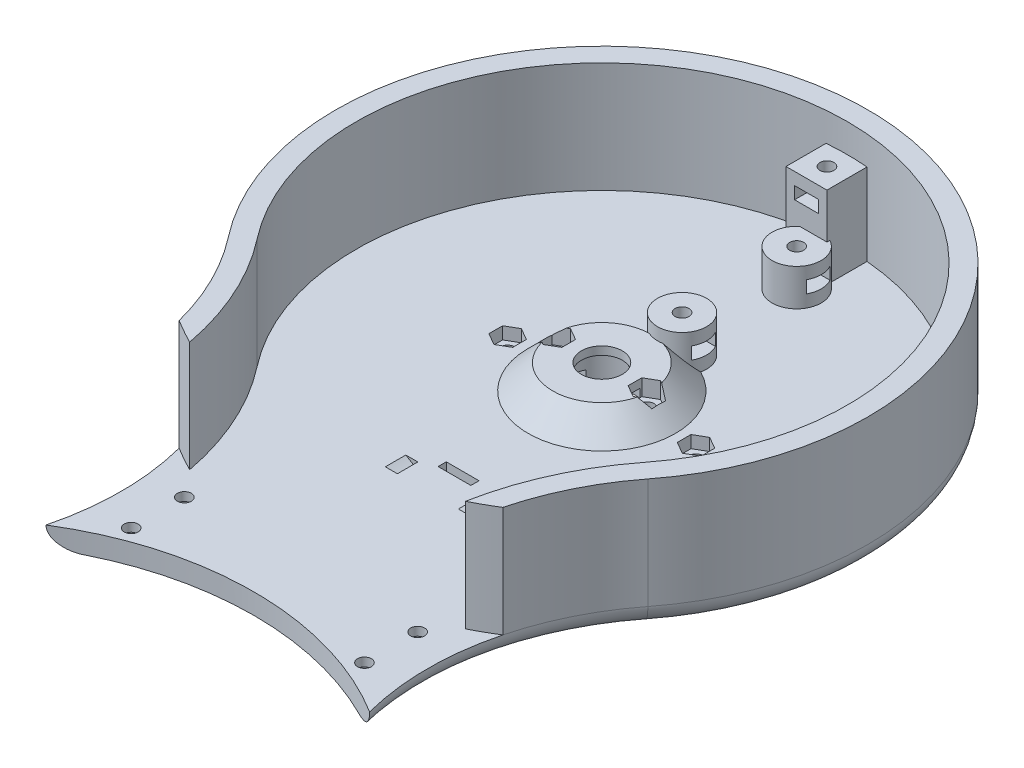
from build123d import *

# Parameters (mm, degrees)
SALIENTE_EXTRUIR1_DEPTH      = 32
CORTAR_EXTRUIR1_DEPTH        = 27
SALIENTE_EXTRUIR2_START      = 20
SALIENTE_EXTRUIR2_DEPTH      = 20
CROQUIS4_R                   = 1.7
CORTAR_EXTRUIR2_DEPTH        = 16
CORTAR_EXTRUIR3_DEPTH        = 1.5
CROQUIS7_R                   = 5
CORTAR_EXTRUIR4_DEPTH        = 11
CROQUIS8_R                   = 8.2
CORTAR_EXTRUIR5_DEPTH        = 9
CROQUIS9_W                   = 30.6
CROQUIS9_H                   = 7
CORTAR_EXTRUIR6_DEPTH        = 4
CROQUIS10_R                  = 1.7
CORTAR_EXTRUIR7_DEPTH        = 16
CORTAR_EXTRUIR8_DEPTH        = 4
CROQUIS12_W                  = 5
CROQUIS12_H                  = 1.5
SALIENTE_EXTRUIR3_START      = 5
SALIENTE_EXTRUIR3_DEPTH      = 5
CROQUIS14_W                  = 4
CROQUIS14_H                  = 1.5
CROQUIS15_R                  = 1.7
CORTAR_EXTRUIR9_DEPTH        = 28
CROQUIS16_R                  = 2.95
CORTAR_EXTRUIR10_DEPTH       = 2.9
SALIENTE_EXTRUIR4_DEPTH      = 3
SALIENTE_EXTRUIR4_DEPTH_BACK = 3
CROQUIS18_R                  = 6
CROQUIS18_R_2                = 1.7
SALIENTE_EXTRUIR5_DEPTH      = 9
CORTAR_EXTRUIR11_DEPTH       = 1.5
CORTAR_EXTRUIR11_DEPTH_BACK  = 1.5
MATRIZL1_START               = 8
MATRIZL1_OUTLINE_R           = 1.7
MATRIZL1_DEPTH               = 3
MATRIZL1_START_2             = 5
MATRIZL1_2_DEPTH             = 9
MATRIZL1_3_OUTLINE_R         = 1.7
MATRIZL1_3_DEPTH             = 3
MATRIZL1_START_3             = 11
MATRIZL1_4_OUTLINE_R         = 1.7
MATRIZL1_4_DEPTH             = 3
MATRIZC1_START               = 8
MATRIZC1_OUTLINE_R           = 1.7
MATRIZC1_DEPTH               = 2.8876
MATRIZC1_START_2             = 5
MATRIZC1_2_DEPTH             = 9
MATRIZC1_3_OUTLINE_R         = 1.7
MATRIZC1_3_DEPTH             = 3
MATRIZC1_START_3             = 11
MATRIZC1_4_OUTLINE_R         = 1.7
MATRIZC1_4_DEPTH             = 3
CROQUIS20_R                  = 4.2
CORTAR_EXTRUIR12_DEPTH       = 1.1
REDONDEO1_R                  = 5
CROQUIS21_R                  = 75
CORTAR_EXTRUIR13_DEPTH       = 57
CORTAR_EXTRUIR14_DEPTH       = 27
CROQUIS23_R                  = 1.7
CORTAR_EXTRUIR15_DEPTH       = 10
CORTAR_EXTRUIR16_DEPTH       = 3
CROQUIS25_W                  = 8
CROQUIS25_H                  = 2
CORTAR_EXTRUIR17_DEPTH       = 9


# Read off the part's stored shape, not the designer's step: MatrizL1, MatrizC1
with BuildPart() as part:
    # Croquis1 → Saliente-Extruir1 (new body)
    with BuildSketch(Plane(origin=(0, 0, 0), x_dir=(1, 0, 0), z_dir=(0, 1, 0))):
        with BuildLine():
            ThreePointArc((51.23475383, 120), (0, 225), (-51.23475383, 120))
            ThreePointArc((-51.23475383, 120), (-37.46950766, 80), (-51.23475383, 40))
            ThreePointArc((-51.23475383, 40), (0, -65), (51.23475383, 40))
            ThreePointArc((51.23475383, 40), (37.46950766, 80), (51.23475383, 120))
        make_face()
    extrude(amount=SALIENTE_EXTRUIR1_DEPTH)

    # Croquis2 → Cortar-Extruir1 (cut)
    with BuildSketch(Plane(origin=(0, 32, 0), x_dir=(1, 0, 0), z_dir=(0, 1, 0))):
        with BuildLine():
            ThreePointArc((47.29361892, 123.076923077), (32.46950766, 80), (47.29361892, 36.923076923))
            ThreePointArc((47.29361892, 36.923076923), (0, -60), (-47.29361892, 36.923076923))
            ThreePointArc((-47.29361892, 36.923076923), (-32.46950766, 80), (-47.29361892, 123.076923077))
            ThreePointArc((-47.29361892, 123.076923077), (0, 220), (47.29361892, 123.076923077))
        make_face()
    extrude(amount=-CORTAR_EXTRUIR1_DEPTH, mode=Mode.SUBTRACT)

    # Croquis3 → Saliente-Extruir2 (add)
    with BuildSketch(Plane(origin=(0, 5, 0), x_dir=(1, 0, 0), z_dir=(0, 1, 0)).offset(SALIENTE_EXTRUIR2_START)):
        with BuildLine():
            Line((-5, -50), (5, -50))
            Line((5, -50), (5, -59.791303716))
            ThreePointArc((5, -59.791303716), (0, -60), (-5, -59.791303716))
            Line((-5, -59.791303716), (-5, -50))
        make_face()
    saliente_extruir2 = extrude(amount=-SALIENTE_EXTRUIR2_DEPTH)

    # Croquis4 → Cortar-Extruir2 (cut)
    with BuildSketch(Plane(origin=(0, 25, 0), x_dir=(1, 0, 0), z_dir=(0, 1, 0))):
        with Locations(Location((0, -55, 0), (0, 0, 270))):
            Circle(CROQUIS4_R)
    cortar_extruir2 = extrude(amount=-CORTAR_EXTRUIR2_DEPTH, mode=Mode.SUBTRACT)

    # Croquis5 → Cortar-Extruir3 (cut, symmetric)
    with BuildSketch(Plane(origin=(0, 20.5, 0), x_dir=(1, 0, 0), z_dir=(0, 1, 0))):
        Polygon((-2.901185103, -53.325), (-2.901185103, -46.675), (2.901185103, -46.675), (2.901185103, -53.325), (2.901185103, -56.675), (0, -58.35), (-2.901185103, -56.675), align=None)
    cortar_extruir3 = extrude(amount=CORTAR_EXTRUIR3_DEPTH, both=True, mode=Mode.SUBTRACT)

    # Croquis6 → Revolución1 (revolve)
    with BuildSketch(Plane.XY, mode=Mode.PRIVATE) as revoluci_n1_sk:
        Polygon((0, 11), (0, 5), (18, 5), (12, 11), align=None)
    revoluci_n1 = revolve(revoluci_n1_sk.sketch.rotate(Axis((0, 11, 0), (0, -1, 0)), 180), axis=Axis((0, 11, 0), (0, -1, 0)))

    # Croquis7 → Cortar-Extruir4 (cut)
    with BuildSketch(Plane(origin=(0, 11, 0), x_dir=(1, 0, 0), z_dir=(0, 1, 0))):
        with Locations(Location((0, 0, 0), (0, 0, 180))):
            Circle(CROQUIS7_R)
    cortar_extruir4 = extrude(amount=-CORTAR_EXTRUIR4_DEPTH, mode=Mode.SUBTRACT)

    # Croquis8 → Cortar-Extruir5 (cut)
    with BuildSketch(Plane.XZ):
        with Locations(Location((0, 0, 0), (0, 0, 270))):
            Circle(CROQUIS8_R)
    cortar_extruir5 = extrude(amount=-CORTAR_EXTRUIR5_DEPTH, mode=Mode.SUBTRACT)

    # Croquis9 → Cortar-Extruir6 (cut)
    with BuildSketch(Plane.XZ):
        Rectangle(CROQUIS9_W, CROQUIS9_H)
    cortar_extruir6 = extrude(amount=-CORTAR_EXTRUIR6_DEPTH, mode=Mode.SUBTRACT)

    # Croquis10 → Cortar-Extruir7 (cut)
    with BuildSketch(Plane.XZ.offset(-4)):
        with Locations(Location((-11, 0, 0), (0, 0, 270))):
            Circle(CROQUIS10_R)
        with Locations(Location((11, 0, 0), (0, 0, 270))):
            Circle(CROQUIS10_R)
    cortar_extruir7 = extrude(amount=-CORTAR_EXTRUIR7_DEPTH, mode=Mode.SUBTRACT)

    # Croquis11 → Cortar-Extruir8 (cut)
    with BuildSketch(Plane(origin=(0, 11, 0), x_dir=(1, 0, 0), z_dir=(0, 1, 0))):
        Polygon((11, 3.35), (8.098814897, 1.675), (8.098814897, -1.675), (11, -3.35), (13.901185103, -1.675), (13.901185103, 1.675), align=None)
        Polygon((-11, 3.35), (-13.901185103, 1.675), (-13.901185103, -1.675), (-11, -3.35), (-8.098814897, -1.675), (-8.098814897, 1.675), align=None)
    cortar_extruir8 = extrude(amount=-CORTAR_EXTRUIR8_DEPTH, mode=Mode.SUBTRACT)

    # Croquis12 → Cortar-Revolución1 (revolve, cut)
    with BuildSketch(Plane(origin=(0, 0, 0), x_dir=(0, 0, -1), z_dir=(1, 0, 0))):
        with Locations((40, 2.5)):
            Rectangle(CROQUIS12_W, CROQUIS12_H)
    cortar_revoluci_n1 = revolve(axis=Axis((0, 20, -15.980405029), (0, 0, -1)), mode=Mode.SUBTRACT)

    # Simetría1: Saliente-Extruir2, Cortar-Extruir2, Cortar-Extruir3, Revolución1, Cortar-Extruir4, Cortar-Extruir5, Cortar-Extruir6, Cortar-Extruir7, Cortar-Extruir8, Cortar-Revolución1 across plane
    add(saliente_extruir2.mirror(Plane.XY.offset(-80)))
    add(cortar_extruir2.mirror(Plane.XY.offset(-80)), mode=Mode.SUBTRACT)
    add(cortar_extruir3.mirror(Plane.XY.offset(-80)), mode=Mode.SUBTRACT)
    add(revoluci_n1.mirror(Plane.XY.offset(-80)))
    add(cortar_extruir4.mirror(Plane.XY.offset(-80)), mode=Mode.SUBTRACT)
    add(cortar_extruir5.mirror(Plane.XY.offset(-80)), mode=Mode.SUBTRACT)
    add(cortar_extruir6.mirror(Plane.XY.offset(-80)), mode=Mode.SUBTRACT)
    add(cortar_extruir7.mirror(Plane.XY.offset(-80)), mode=Mode.SUBTRACT)
    add(cortar_extruir8.mirror(Plane.XY.offset(-80)), mode=Mode.SUBTRACT)
    add(cortar_revoluci_n1.mirror(Plane.XY.offset(-80)), mode=Mode.SUBTRACT)

    # Croquis13 → Saliente-Extruir3 (add)
    with BuildSketch(Plane(origin=(0, 5, 0), x_dir=(1, 0, 0), z_dir=(0, 1, 0)).offset(SALIENTE_EXTRUIR3_START)):
        with BuildLine():
            ThreePointArc((-33.685420375, 67.009644486), (-32.46950766, 80), (-33.685420375, 92.990355514))
            ThreePointArc((-33.685420375, 92.990355514), (0, 85), (33.685420375, 92.990355514))
            ThreePointArc((33.685420375, 92.990355514), (32.46950766, 80), (33.685420375, 67.009644486))
            ThreePointArc((33.685420375, 67.009644486), (0, 75), (-33.685420375, 67.009644486))
        make_face()
    extrude(amount=-SALIENTE_EXTRUIR3_DEPTH)

    # Croquis14 → Cortar-Revolución2 (revolve, cut)
    with BuildSketch(Plane(origin=(0, 0, 0), x_dir=(0, 0, -1), z_dir=(1, 0, 0))):
        with Locations((80, 7.75)):
            Rectangle(CROQUIS14_W, CROQUIS14_H)
    revolve(axis=Axis((0, 25, -45.111701589), (0, 0, -1)), mode=Mode.SUBTRACT)

    # Croquis15 → Cortar-Extruir9 (cut)
    with BuildSketch(Plane(origin=(0, 10, 0), x_dir=(1, 0, 0), z_dir=(0, 1, 0))):
        with Locations(Location((-28.5, 86.5, 0), (0, 0, 270))):
            Circle(CROQUIS15_R)
        with Locations(Location((-28.5, 73.5, 0), (0, 0, 270))):
            Circle(CROQUIS15_R)
        with Locations(Location((28.5, 86.5, 0), (0, 0, 270))):
            Circle(CROQUIS15_R)
        with Locations(Location((28.5, 73.5, 0), (0, 0, 270))):
            Circle(CROQUIS15_R)
    extrude(amount=-CORTAR_EXTRUIR9_DEPTH, mode=Mode.SUBTRACT)

    # Croquis16 → Cortar-Extruir10 (cut)
    with BuildSketch(Plane.XZ):
        with Locations(Location((-28.5, -73.5, 0), (0, 0, 270))):
            Circle(CROQUIS16_R)
        with Locations(Location((-28.5, -86.5, 0), (0, 0, 270))):
            Circle(CROQUIS16_R)
        with Locations(Location((28.5, -86.5, 0), (0, 0, 270))):
            Circle(CROQUIS16_R)
        with Locations(Location((28.5, -73.5, 0), (0, 0, 270))):
            Circle(CROQUIS16_R)
    extrude(amount=-CORTAR_EXTRUIR10_DEPTH, mode=Mode.SUBTRACT)

    # Croquis17 → Saliente-Extruir4 (add, two sides: drawn at the far end of the back side and taken through both)
    with BuildSketch(Plane.XY.offset(-80).offset(-SALIENTE_EXTRUIR4_DEPTH_BACK)):
        Polygon((-35, 24), (-35, 14), (-25, 24), align=None)
        Polygon((25, 24), (35, 24), (35, 14), align=None)
    extrude(amount=SALIENTE_EXTRUIR4_DEPTH + SALIENTE_EXTRUIR4_DEPTH_BACK)

    # Croquis18 → Saliente-Extruir5 (add)
    with BuildSketch(Plane(origin=(0, 5, 0), x_dir=(1, 0, 0), z_dir=(0, 1, 0))):
        with Locations((-2.2, -45.4)):
            Circle(CROQUIS18_R)
        with Locations(Location((-2.2, -45.4, 0), (0, 0, 270))):
            Circle(CROQUIS18_R_2, mode=Mode.SUBTRACT)
    extrude(amount=SALIENTE_EXTRUIR5_DEPTH)

    # Croquis19 → Cortar-Extruir11 (cut, two sides: drawn at the far end of the back side and taken through both)
    with BuildSketch(Plane(origin=(0, 9.5, 0), x_dir=(1, 0, 0), z_dir=(0, 1, 0)).offset(-CORTAR_EXTRUIR11_DEPTH_BACK)):
        Polygon((-3.875, -42.498814897), (-10.525, -42.498814897), (-10.525, -48.301185103), (-3.875, -48.301185103), (-0.525, -48.301185103), (1.15, -45.4), (-0.525, -42.498814897), align=None)
    extrude(amount=CORTAR_EXTRUIR11_DEPTH + CORTAR_EXTRUIR11_DEPTH_BACK, mode=Mode.SUBTRACT)

    # MatrizL1 outline → MatrizL1 (cut)
    with BuildSketch(Plane(origin=(0, 0, 0), x_dir=(1, 0, 0), z_dir=(0, 1, 0)).offset(MATRIZL1_START)):
        with BuildLine():
            Line((-0.525, -14.498814897), (-7.451963918, -14.498814897))
            ThreePointArc((-7.451963918, -14.498814897), (-8.2, -17.4), (-7.451963918, -20.301185103))
            Line((-7.451963918, -20.301185103), (-0.525, -20.301185103))
            Line((-0.525, -20.301185103), (1.15, -17.4))
            Line((1.15, -17.4), (-0.525, -14.498814897))
        make_face()
        with Locations((-2.2, -17.4)):
            Circle(MATRIZL1_OUTLINE_R, mode=Mode.SUBTRACT)
    extrude(amount=MATRIZL1_DEPTH, mode=Mode.SUBTRACT)

    # MatrizL1 2 outline → MatrizL1 2 (add)
    with BuildSketch(Plane(origin=(0, 0, 0), x_dir=(1, 0, 0), z_dir=(0, 1, 0)).offset(MATRIZL1_START_2)):
        with BuildLine():
            ThreePointArc((-7.451963918, -20.301185103), (3.8, -17.4), (-7.451963918, -14.498814897))
            Line((-7.451963918, -14.498814897), (-0.525, -14.498814897))
            Line((-0.525, -14.498814897), (1.15, -17.4))
            Line((1.15, -17.4), (-0.525, -20.301185103))
            Line((-0.525, -20.301185103), (-7.451963918, -20.301185103))
        make_face()
    extrude(amount=MATRIZL1_2_DEPTH)

    # MatrizL1 3 outline → MatrizL1 3 (add)
    with BuildSketch(Plane(origin=(0, 0, 0), x_dir=(1, 0, 0), z_dir=(0, 1, 0)).offset(MATRIZL1_START_2)):
        with BuildLine():
            Line((-0.525, -14.498814897), (-7.451963918, -14.498814897))
            ThreePointArc((-7.451963918, -14.498814897), (-8.2, -17.4), (-7.451963918, -20.301185103))
            Line((-7.451963918, -20.301185103), (-0.525, -20.301185103))
            Line((-0.525, -20.301185103), (1.15, -17.4))
            Line((1.15, -17.4), (-0.525, -14.498814897))
        make_face()
        with Locations((-2.2, -17.4)):
            Circle(MATRIZL1_3_OUTLINE_R, mode=Mode.SUBTRACT)
    extrude(amount=MATRIZL1_3_DEPTH)

    # MatrizL1 4 outline → MatrizL1 4 (add)
    with BuildSketch(Plane(origin=(0, 0, 0), x_dir=(1, 0, 0), z_dir=(0, 1, 0)).offset(MATRIZL1_START_3)):
        with BuildLine():
            Line((-0.525, -14.498814897), (-7.451963918, -14.498814897))
            ThreePointArc((-7.451963918, -14.498814897), (-8.2, -17.4), (-7.451963918, -20.301185103))
            Line((-7.451963918, -20.301185103), (-0.525, -20.301185103))
            Line((-0.525, -20.301185103), (1.15, -17.4))
            Line((1.15, -17.4), (-0.525, -14.498814897))
        make_face()
        with Locations((-2.2, -17.4)):
            Circle(MATRIZL1_4_OUTLINE_R, mode=Mode.SUBTRACT)
    extrude(amount=MATRIZL1_4_DEPTH)

    # MatrizC1 outline → MatrizC1 (cut)
    with BuildSketch(Plane(origin=(0, 0, 0), x_dir=(1, 0, 0), z_dir=(0, 1, 0)).offset(MATRIZC1_START)):
        with BuildLine():
            ThreePointArc((7.451963918, 174.498814897), (8.2, 177.4), (7.451963918, 180.301185103))
            Line((7.451963918, 180.301185103), (0.525, 180.301185103))
            Line((0.525, 180.301185103), (-1.15, 177.4))
            Line((-1.15, 177.4), (0.525, 174.498814897))
            Line((0.525, 174.498814897), (7.451963918, 174.498814897))
        make_face()
        with Locations((2.2, 177.4)):
            Circle(MATRIZC1_OUTLINE_R, mode=Mode.SUBTRACT)
    extrude(amount=MATRIZC1_DEPTH, mode=Mode.SUBTRACT)

    # MatrizC1 2 outline → MatrizC1 2 (add)
    with BuildSketch(Plane(origin=(0, 0, 0), x_dir=(1, 0, 0), z_dir=(0, 1, 0)).offset(MATRIZC1_START_2)):
        with BuildLine():
            ThreePointArc((7.451963918, 208.301185103), (6.401789564, 209.683102201), (5, 210.706599665))
            Line((5, 210.706599665), (5, 210))
            Line((5, 210), (-1.652272057, 210))
            ThreePointArc((-1.652272057, 210), (-1.61532814, 200.769312018), (7.451963918, 202.498814897))
            Line((7.451963918, 202.498814897), (0.525, 202.498814897))
            Line((0.525, 202.498814897), (-1.15, 205.4))
            Line((-1.15, 205.4), (0.525, 208.301185103))
            Line((0.525, 208.301185103), (7.451963918, 208.301185103))
        make_face()
        with BuildLine():
            Line((0.525, 180.301185103), (7.451963918, 180.301185103))
            ThreePointArc((7.451963918, 180.301185103), (-3.8, 177.4), (7.451963918, 174.498814897))
            Line((7.451963918, 174.498814897), (0.525, 174.498814897))
            Line((0.525, 174.498814897), (-1.15, 177.4))
            Line((-1.15, 177.4), (0.525, 180.301185103))
        make_face()
    extrude(amount=MATRIZC1_2_DEPTH)

    # MatrizC1 3 outline → MatrizC1 3 (add)
    # profile 1 of 2: a face of its own
    with BuildSketch(Plane(origin=(0, 0, 0), x_dir=(1, 0, 0), z_dir=(0, 1, 0)).offset(MATRIZC1_START_2)):
        with BuildLine():
            ThreePointArc((7.451963918, 202.498814897), (8.2, 205.4), (7.451963918, 208.301185103))
            Line((7.451963918, 208.301185103), (0.525, 208.301185103))
            Line((0.525, 208.301185103), (-1.15, 205.4))
            Line((-1.15, 205.4), (0.525, 202.498814897))
            Line((0.525, 202.498814897), (7.451963918, 202.498814897))
        make_face()
        with Locations((2.2, 205.4)):
            Circle(MATRIZC1_3_OUTLINE_R, mode=Mode.SUBTRACT)
    # profile 2 of 2: a face of its own
    with BuildSketch(Plane(origin=(0, 0, 0), x_dir=(1, 0, 0), z_dir=(0, 1, 0)).offset(MATRIZC1_START_2)):
        with BuildLine():
            ThreePointArc((7.451963918, 174.498814897), (8.2, 177.4), (7.451963918, 180.301185103))
            Line((7.451963918, 180.301185103), (0.525, 180.301185103))
            Line((0.525, 180.301185103), (-1.15, 177.4))
            Line((-1.15, 177.4), (0.525, 174.498814897))
            Line((0.525, 174.498814897), (7.451963918, 174.498814897))
        make_face()
        with Locations((2.2, 177.4)):
            Circle(MATRIZC1_3_OUTLINE_R, mode=Mode.SUBTRACT)
    extrude(amount=MATRIZC1_3_DEPTH)

    # MatrizC1 4 outline → MatrizC1 4 (add)
    # profile 1 of 2: a face of its own
    with BuildSketch(Plane(origin=(0, 0, 0), x_dir=(1, 0, 0), z_dir=(0, 1, 0)).offset(MATRIZC1_START_3)):
        with BuildLine():
            ThreePointArc((7.451963918, 202.498814897), (8.2, 205.4), (7.451963918, 208.301185103))
            Line((7.451963918, 208.301185103), (0.525, 208.301185103))
            Line((0.525, 208.301185103), (-1.15, 205.4))
            Line((-1.15, 205.4), (0.525, 202.498814897))
            Line((0.525, 202.498814897), (7.451963918, 202.498814897))
        make_face()
        with Locations((2.2, 205.4)):
            Circle(MATRIZC1_4_OUTLINE_R, mode=Mode.SUBTRACT)
    # profile 2 of 2: a face of its own
    with BuildSketch(Plane(origin=(0, 0, 0), x_dir=(1, 0, 0), z_dir=(0, 1, 0)).offset(MATRIZC1_START_3)):
        with BuildLine():
            ThreePointArc((7.451963918, 174.498814897), (8.2, 177.4), (7.451963918, 180.301185103))
            Line((7.451963918, 180.301185103), (0.525, 180.301185103))
            Line((0.525, 180.301185103), (-1.15, 177.4))
            Line((-1.15, 177.4), (0.525, 174.498814897))
            Line((0.525, 174.498814897), (7.451963918, 174.498814897))
        make_face()
        with Locations((2.2, 177.4)):
            Circle(MATRIZC1_4_OUTLINE_R, mode=Mode.SUBTRACT)
    extrude(amount=MATRIZC1_4_DEPTH)

    # Croquis20 → Cortar-Extruir12 (cut)
    with BuildSketch(Plane.XZ):
        with Locations(Location((0, 54.5, 0), (0, 0, 270))):
            Circle(CROQUIS20_R)
        with Locations(Location((0, -80, 0), (0, 0, 270))):
            Circle(CROQUIS20_R)
        with Locations(Location((0, -214.5, 0), (0, 0, 270))):
            Circle(CROQUIS20_R)
    extrude(amount=-CORTAR_EXTRUIR12_DEPTH, mode=Mode.SUBTRACT)

    # Redondeo1
    redondeo1_edges = [part.edges().sort_by_distance(p)[0] for p in [
        (0, 0, 65),
        (-37.46950766, 0, -80),
        (0, 0, -225),
        (37.46950766, 0, -80),
    ]]
    fillet(redondeo1_edges, radius=REDONDEO1_R)

    # Croquis21 → Cortar-Extruir13 (cut)
    with BuildSketch(Plane(origin=(0, 32, 0), x_dir=(1, 0, 0), z_dir=(0, 1, 0))):
        Circle(CROQUIS21_R)
    extrude(amount=-CORTAR_EXTRUIR13_DEPTH, mode=Mode.SUBTRACT)

    # Croquis22 → Cortar-Extruir14 (cut)
    with BuildSketch(Plane(origin=(0, 32, 0), x_dir=(1, 0, 0), z_dir=(0, 1, 0))):
        with BuildLine():
            Line((-50, 39.098300563), (50, 39.098300563))
            Line((50, 39.098300563), (50, 104.098300563))
            ThreePointArc((50, 104.098300563), (0, 85), (-50, 104.098300563))
            Line((-50, 104.098300563), (-50, 39.098300563))
        make_face()
    extrude(amount=-CORTAR_EXTRUIR14_DEPTH, mode=Mode.SUBTRACT)

    # Croquis23 → Cortar-Extruir15 (cut)
    with BuildSketch(Plane.XZ):
        with Locations(Location((-23.0125, -160, 0), (0, 0, 270))):
            Circle(CROQUIS23_R)
        with Locations(Location((23.0125, -160, 0), (0, 0, 270))):
            Circle(CROQUIS23_R)
    extrude(amount=-CORTAR_EXTRUIR15_DEPTH, mode=Mode.SUBTRACT)

    # Croquis24 → Cortar-Extruir16 (cut)
    with BuildSketch(Plane(origin=(0, 5, 0), x_dir=(1, 0, 0), z_dir=(0, 1, 0))):
        Polygon((-23.0125, 163.35), (-25.913685103, 161.675), (-25.913685103, 158.325), (-23.0125, 156.65), (-20.111314897, 158.325), (-20.111314897, 161.675), align=None)
        Polygon((23.0125, 163.35), (20.111314897, 161.675), (20.111314897, 158.325), (23.0125, 156.65), (25.913685103, 158.325), (25.913685103, 161.675), align=None)
    extrude(amount=-CORTAR_EXTRUIR16_DEPTH, mode=Mode.SUBTRACT)

    # Croquis25 → Cortar-Extruir17 (cut)
    with BuildSketch(Plane.XZ):
        with Locations((0, -125)):
            Rectangle(CROQUIS25_W, CROQUIS25_H)
    extrude(amount=-CORTAR_EXTRUIR17_DEPTH, mode=Mode.SUBTRACT)


solid = part.part
